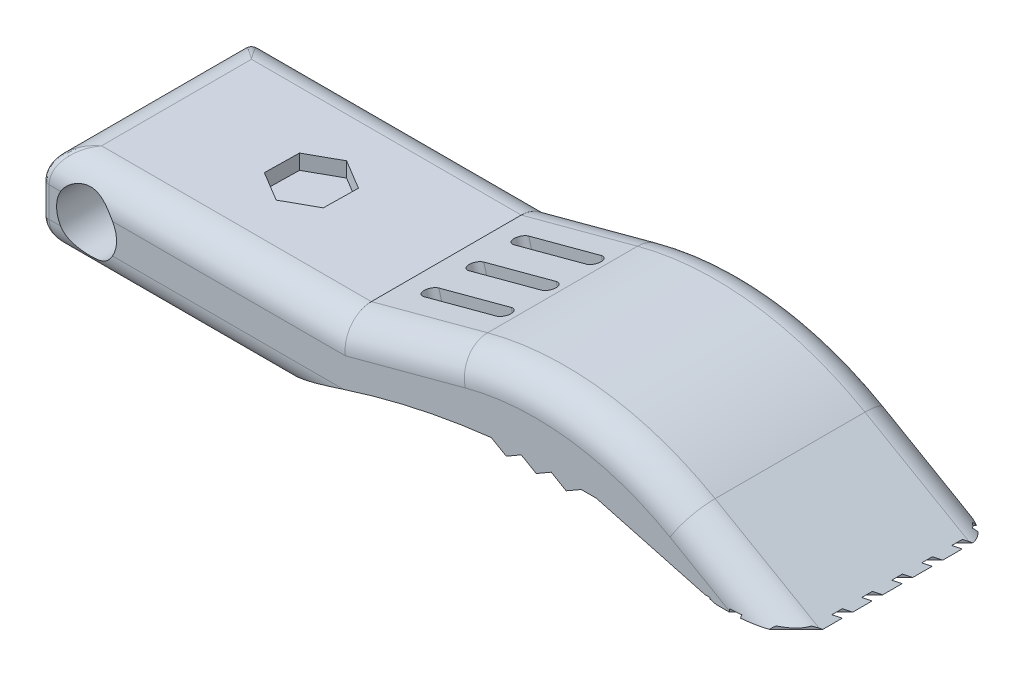
from build123d import *

# Parameters (mm, degrees)
BOSS_EXTRUDE1_DEPTH  = 14
FILLET1_R            = 2
FILLET1_R_2          = 0.5
SKETCH2_R            = 2
CUT_EXTRUDE1_DEPTH   = 3
CUT_EXTRUDE2_DEPTH   = 1
CUT_EXTRUDE3_DEPTH   = 1
LPATTERN1_COUNT      = 2
LPATTERN1_PITCH      = 3
LPATTERN1_COUNT_DIR2 = 2
LPATTERN1_PITCH_DIR2 = 3
CUT_EXTRUDE4_DEPTH   = 0.2
LPATTERN2_COUNT      = 5
LPATTERN2_PITCH      = 2
LPATTERN2_COUNT_DIR2 = 6
LPATTERN2_PITCH_DIR2 = 2


with BuildPart() as part:
    # Sketch1 → Boss-Extrude1 (new body)
    with BuildSketch(Plane.XY):
        with BuildLine():
            Line((-10, 0), (-25, 0))
            Line((-25, 0), (-25, 6))
            Line((-25, 6), (-5, 6))
            Line((-5, 6), (2.756338699, 8.078304691))
            ThreePointArc((2.756338699, 8.078304691), (10.543243446, 8.588685392), (17.932719601, 6.080296241))
            Line((17.932719601, 6.080296241), (25, 2))
            Line((25, 2), (20, 2))
            Line((20, 2), (12, 4.143593539))
            Line((12, 4.143593539), (11, 4.143593539))
            Line((11, 4.143593539), (10, 3.56624327))
            Line((10, 3.56624327), (9, 4.143593539))
            Line((9, 4.143593539), (8, 3.56624327))
            Line((8, 3.56624327), (7, 4.143593539))
            Line((7, 4.143593539), (6, 3.56624327))
            Line((6, 3.56624327), (5, 4.143593539))
            ThreePointArc((5, 4.143593539), (-2.662192319, 2.658940457), (-10, 0))
        make_face()
    extrude(amount=BOSS_EXTRUDE1_DEPTH)

    # Fillet1
    fillet1_edges = [part.edges().sort_by_distance(p)[0] for p in [
        (-15, 6, 14),
        (-15, 6, 0),
        (10.543243446, 8.588685392, 0),
        (-1.12183065, 7.039152345, 14),
        (-25, 6, 7),
        (-25, 0, 7),
        (-17.5, 0, 14),
        (-17.5, 0, 0),
        (10.543243446, 8.588685392, 14),
        (21.466359801, 4.04014812, 14),
        (-1.12183065, 7.039152345, 0),
        (21.466359801, 4.04014812, 0),
    ]]
    fillet(fillet1_edges, radius=FILLET1_R)
    fillet1_2_edges = [part.edges().sort_by_distance(p)[0] for p in [
        (-25, 3, 14),
        (-25, 3, 0),
        (-24.414213562, 0.585786438, 0.585786438),
        (-24.414213562, 5.414213562, 0.585786438),
        (-24.414213562, 0.585786438, 13.414213562),
        (-24.414213562, 5.414213562, 13.414213562),
    ]]
    fillet(fillet1_2_edges, radius=FILLET1_R_2)

    # Sketch2 → Cut-Extrude1 (cut)
    with BuildSketch(Plane.XY.offset(14)):
        with Locations((-22, 3.003399689)):
            Circle(SKETCH2_R)
    extrude(amount=-CUT_EXTRUDE1_DEPTH, mode=Mode.SUBTRACT)

    # Sketch3 → Cut-Extrude2 (cut)
    with BuildSketch(Plane(origin=(0, 6, 0), x_dir=(1, 0, 0), z_dir=(0, 1, 0))):
        Polygon((-12.019704914, -8.188177052), (-11.980860946, -5.879102674), (-13.961156032, -4.690925623), (-15.980295086, -5.811822948), (-16.019139054, -8.120897326), (-14.038843968, -9.309074377), align=None)
    extrude(amount=-CUT_EXTRUDE2_DEPTH, mode=Mode.SUBTRACT)

    # Sketch4 → Cut-Extrude3 (cut)
    with BuildSketch(Plane(origin=(-1.834936491, 6.848076211, 0), x_dir=(0.965925826289068, 0.258819045102522, 0), z_dir=(-0.258819045102522, 0.965925826289068, 0))):
        with BuildLine():
            Line((-1.198655914, -6.5), (3.801344086, -6.5))
            ThreePointArc((3.801344086, -6.5), (4.301344086, -7), (3.801344086, -7.5))
            Line((3.801344086, -7.5), (-1.198655914, -7.5))
            ThreePointArc((-1.198655914, -7.5), (-1.698655914, -7), (-1.198655914, -6.5))
        make_face()
    cut_extrude3 = extrude(amount=-CUT_EXTRUDE3_DEPTH, mode=Mode.SUBTRACT)

    # LPattern1: Cut-Extrude3 2 × 2
    with Locations(*[Vector(0, 0, -1) * (i * LPATTERN1_PITCH) + Vector(0, 0, 1) * (j * LPATTERN1_PITCH_DIR2) for i in range(LPATTERN1_COUNT) for j in range(LPATTERN1_COUNT_DIR2) if (i, j) != (0, 0)]):
        add(cut_extrude3, mode=Mode.SUBTRACT)

    # Sketch5 → Cut-Extrude4 (cut)
    with BuildSketch(Plane.XZ.offset(-2)):
        Polygon((27.360676424, 1.519922446), (16.754074707, 12.126524164), (17.107628097, 12.480077554), (27.714229815, 1.873475836), align=None)
    cut_extrude4 = extrude(amount=-CUT_EXTRUDE4_DEPTH, mode=Mode.SUBTRACT)

    # LPattern2: Cut-Extrude4 5 × 6
    with Locations(*[Vector(0, 0, 1) * (i * LPATTERN2_PITCH) + Vector(0, 0, -1) * (j * LPATTERN2_PITCH_DIR2) for i in range(LPATTERN2_COUNT) for j in range(LPATTERN2_COUNT_DIR2) if (i, j) != (0, 0)]):
        add(cut_extrude4, mode=Mode.SUBTRACT)


solid = part.part
